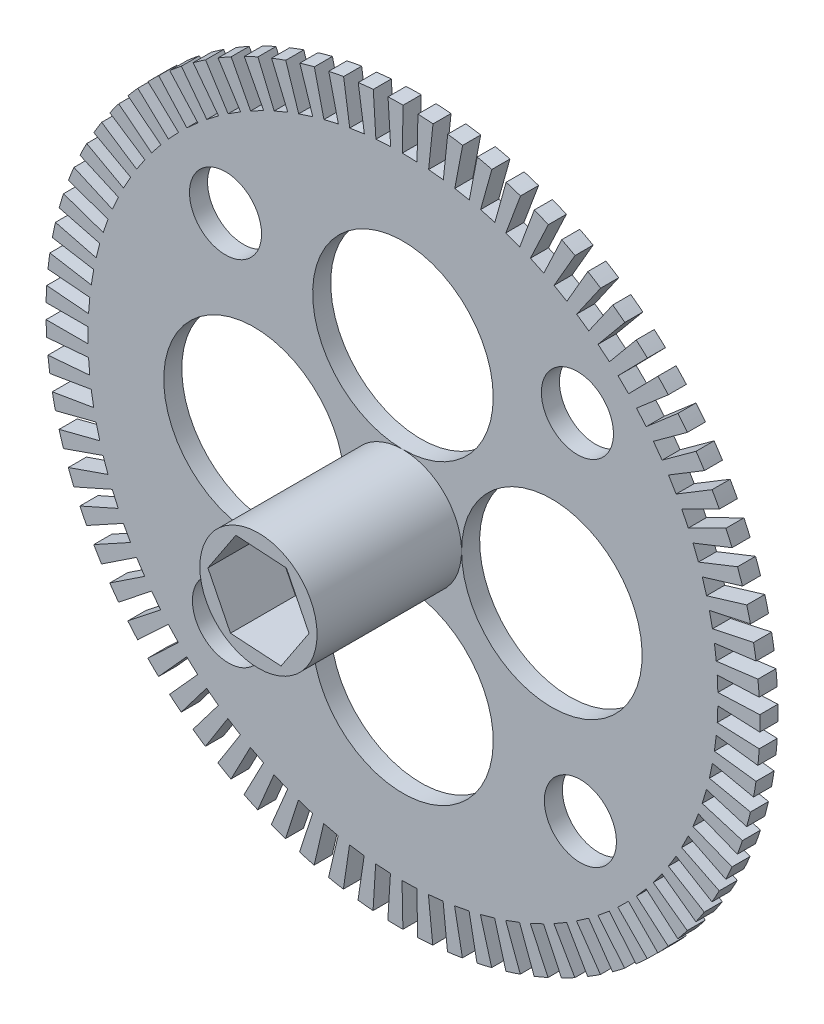
from build123d import *

# Parameters (mm, degrees)
BOSS_EXTRUDE1_DEPTH = 2.5
SKETCH9_W           = 6.119344868
SKETCH9_H           = 2.048908969
CUT_EXTRUDE9_DEPTH  = 2.5
CIRPATTERN6_COUNT   = 75
SKETCH12_R          = 50.308958492
SKETCH12_R_2        = 49.410445804
CUT_EXTRUDE10_DEPTH = 2.5
SKETCH14_R          = 12.498456219
CUT_EXTRUDE11_DEPTH = 2.5
CIRPATTERN7_COUNT   = 4
SKETCH15_R          = 4.988276286
CUT_EXTRUDE12_DEPTH = 2.5
CIRPATTERN8_COUNT   = 4
SKETCH16_R          = 8.114955901
BOSS_EXTRUDE2_DEPTH = 20
SKETCH17_R          = 5.23255839
CUT_EXTRUDE13_DEPTH = 50
SKETCH18_R          = 5.23255839
BOSS_EXTRUDE3_DEPTH = 23
CUT_EXTRUDE14_DEPTH = 9
CUT_EXTRUDE15_DEPTH = 9


with BuildPart() as part:
    # Sketch1 → Boss-Extrude1 (new body)
    with BuildSketch(Plane.XY):
        with BuildLine():
            ThreePointArc((-50, 0), (0, -50), (50, 0))
            ThreePointArc((50, 0), (0, 50), (-50, 0))
        make_face()
    extrude(amount=BOSS_EXTRUDE1_DEPTH)

    # Sketch9 → Cut-Extrude9 (cut)
    with BuildSketch(Plane.XY.offset(2.5)):
        with Locations((-46.648856582, 0.015482159)):
            Rectangle(SKETCH9_W, SKETCH9_H)
    cut_extrude9 = extrude(amount=-CUT_EXTRUDE9_DEPTH, mode=Mode.SUBTRACT)

    # CirPattern6: Cut-Extrude9 ×75 about axis
    cirpattern6_axis = Axis((0, 0, 2.5), (0, 0, 1))
    for i in range(1, CIRPATTERN6_COUNT):
        add(cut_extrude9.rotate(cirpattern6_axis, i * 360 / CIRPATTERN6_COUNT), mode=Mode.SUBTRACT)

    # Sketch12 → Cut-Extrude10 (cut)
    with BuildSketch(Plane.XY.offset(2.5)):
        Circle(SKETCH12_R)
        Circle(SKETCH12_R_2, mode=Mode.SUBTRACT)
    extrude(amount=-CUT_EXTRUDE10_DEPTH, mode=Mode.SUBTRACT)

    # Sketch14 → Cut-Extrude11 (cut)
    with BuildSketch(Plane.XY.offset(2.5)):
        with Locations((0, 20.61341212)):
            Circle(SKETCH14_R)
    cut_extrude11 = extrude(amount=-CUT_EXTRUDE11_DEPTH, mode=Mode.SUBTRACT)

    # CirPattern7: Cut-Extrude11 ×4 about axis
    cirpattern7_axis = Axis((0, 0, 2.5), (0, 0, 1))
    for i in range(1, CIRPATTERN7_COUNT):
        add(cut_extrude11.rotate(cirpattern7_axis, i * 360 / CIRPATTERN7_COUNT), mode=Mode.SUBTRACT)

    # Sketch15 → Cut-Extrude12 (cut)
    with BuildSketch(Plane.XY.offset(2.5)):
        with Locations((-24.562709167, 24.154342621)):
            Circle(SKETCH15_R)
    cut_extrude12 = extrude(amount=-CUT_EXTRUDE12_DEPTH, mode=Mode.SUBTRACT)

    # CirPattern8: Cut-Extrude12 ×4 about axis
    cirpattern8_axis = Axis((0, 0, 2.5), (0, 0, 1))
    for i in range(1, CIRPATTERN8_COUNT):
        add(cut_extrude12.rotate(cirpattern8_axis, i * 360 / CIRPATTERN8_COUNT), mode=Mode.SUBTRACT)

    # Sketch16 → Boss-Extrude2 (add)
    with BuildSketch(Plane.XY.offset(2.5)):
        Circle(SKETCH16_R)
    extrude(amount=BOSS_EXTRUDE2_DEPTH)

    # Sketch17 → Cut-Extrude13 (cut)
    with BuildSketch(Plane.XY.offset(22.5)):
        Circle(SKETCH17_R)
    extrude(amount=-CUT_EXTRUDE13_DEPTH, mode=Mode.SUBTRACT)

    # Sketch18 → Boss-Extrude3 (add)
    with BuildSketch(Plane.XY.offset(22.5)):
        Circle(SKETCH18_R)
    extrude(amount=-BOSS_EXTRUDE3_DEPTH)

    # Sketch19 → Cut-Extrude14 (cut)
    with BuildSketch(Plane.XY.offset(22.5)):
        Polygon((-3.127071438, 6.277488232), (-7, 0.430620811), (-3.872928562, -5.846867421), (3.127071438, -6.277488232), (7, -0.430620811), (3.872928562, 5.846867421), align=None)
    extrude(amount=-CUT_EXTRUDE14_DEPTH, mode=Mode.SUBTRACT)

    # Sketch20 → Cut-Extrude15 (cut)
    with BuildSketch(Plane(origin=(0, 0, -0.5), x_dir=(-1, 0, 0), z_dir=(0, 0, -1))):
        Polygon((1.574713792, 6.82057743), (-5.119436427, 4.774030862), (-6.694150218, -2.046546568), (-1.574713792, -6.82057743), (5.119436427, -4.774030862), (6.694150218, 2.046546568), align=None)
    extrude(amount=-CUT_EXTRUDE15_DEPTH, mode=Mode.SUBTRACT)


solid = part.part
